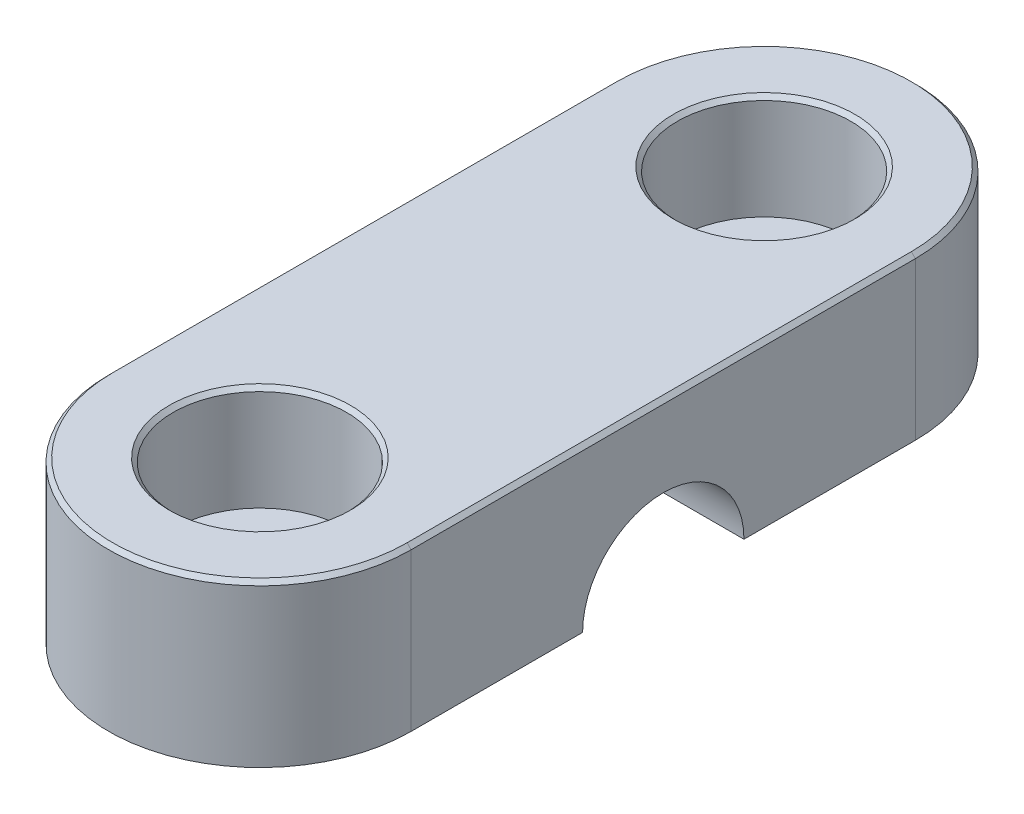
from build123d import *

# Parameters (mm, degrees)
SKETCH1_R           = 2.6
BOSS_EXTRUDE1_DEPTH = 8
CUT_EXTRUDE1_REACH  = 28.249
SKETCH2_R           = 4
SKETCH3_R           = 4.3
CUT_EXTRUDE2_DEPTH  = 5.2
CHAMFER1_SIZE       = 0.2


with BuildPart() as part:
    # Sketch1 → Boss-Extrude1 (new body)
    with BuildSketch(Plane(origin=(0, 0, 0), x_dir=(1, 0, 0), z_dir=(0, 1, 0))):
        with BuildLine():
            ThreePointArc((7.5, 12.5), (0, 20), (-7.5, 12.5))
            Line((-7.5, 12.5), (-7.5, -12.499999986))
            ThreePointArc((-7.5, -12.499999986), (-7e-09, -20), (7.5, -12.5))
            Line((7.5, -12.5), (7.5, 12.5))
        make_face()
        with Locations((0, 12.5)):
            Circle(SKETCH1_R, mode=Mode.SUBTRACT)
        with Locations((0, -12.5)):
            Circle(SKETCH1_R, mode=Mode.SUBTRACT)
    extrude(amount=BOSS_EXTRUDE1_DEPTH)

    # Sketch2 → Cut-Extrude1 (cut, up to next)
    with BuildSketch(Plane(origin=(7.5, 0, 0), x_dir=(0, 0, -1), z_dir=(1, 0, 0)), mode=Mode.PRIVATE) as cut_extrude1_sk1:
        Circle(SKETCH2_R)
    cut_extrude1_tool1 = extrude(cut_extrude1_sk1.sketch, amount=-CUT_EXTRUDE1_REACH, mode=Mode.PRIVATE) & part.part
    add(cut_extrude1_tool1.solids().sort_by_distance((7.5, 0, 0))[0], mode=Mode.SUBTRACT)

    # Sketch3 → Cut-Extrude2 (cut)
    with BuildSketch(Plane(origin=(0, 8, 0), x_dir=(1, 0, 0), z_dir=(0, 1, 0))):
        with Locations((0, 12.5)):
            Circle(SKETCH3_R)
        with Locations((0, -12.5)):
            Circle(SKETCH3_R)
    extrude(amount=-CUT_EXTRUDE2_DEPTH, mode=Mode.SUBTRACT)

    # Chamfer1
    chamfer1_edges = [part.edges().sort_by_distance(p)[0] for p in [
        (7.5, 8, 0),
        (-7e-09, 8, 20),
        (-7.5, 8, -7e-09),
        (0, 8, -20),
        (-4.3, 8, 12.5),
        (-4.3, 8, -12.5),
    ]]
    chamfer(chamfer1_edges, length=CHAMFER1_SIZE)


solid = part.part
